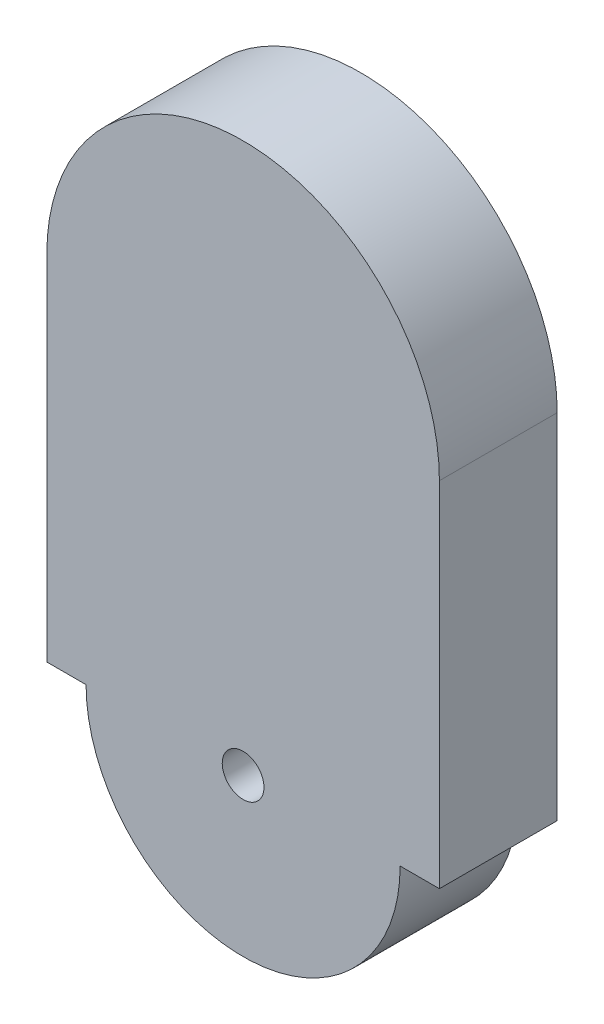
from build123d import *

# Parameters (mm, degrees)
BOSS_EXTRUDE1_DEPTH                              = 19.05
CBORE_FOR_1_4_BUTTON_HEAD_CAP_SCREW1_D           = 6.7564
CBORE_FOR_1_4_BUTTON_HEAD_CAP_SCREW1_CBORE_D     = 11.90752
CBORE_FOR_1_4_BUTTON_HEAD_CAP_SCREW1_CBORE_DEPTH = 6.35


with BuildPart() as part:
    # Sketch2 → Boss-Extrude1 (new body)
    with BuildSketch(Plane.XY):
        with BuildLine():
            Line((31.75, 28.575), (31.75, -28.575))
            Line((31.75, -28.575), (25.4, -28.575))
            ThreePointArc((25.4, -28.575), (0, -53.975), (-25.4, -28.575))
            Line((-25.4, -28.575), (-31.75, -28.575))
            Line((-31.75, -28.575), (-31.75, 28.575))
            ThreePointArc((-31.75, 28.575), (0, 60.325), (31.75, 28.575))
        make_face()
    extrude(amount=BOSS_EXTRUDE1_DEPTH)

    # CBORE for 1/4 Button Head Cap Screw1 (through all)
    with Locations(Plane(origin=(0, 0, 0), x_dir=(-1, 0, 0), z_dir=(0, 0, -1))):
        with Locations((0, -28.575)):
            CounterBoreHole(CBORE_FOR_1_4_BUTTON_HEAD_CAP_SCREW1_D / 2, CBORE_FOR_1_4_BUTTON_HEAD_CAP_SCREW1_CBORE_D / 2, CBORE_FOR_1_4_BUTTON_HEAD_CAP_SCREW1_CBORE_DEPTH)


solid = part.part
